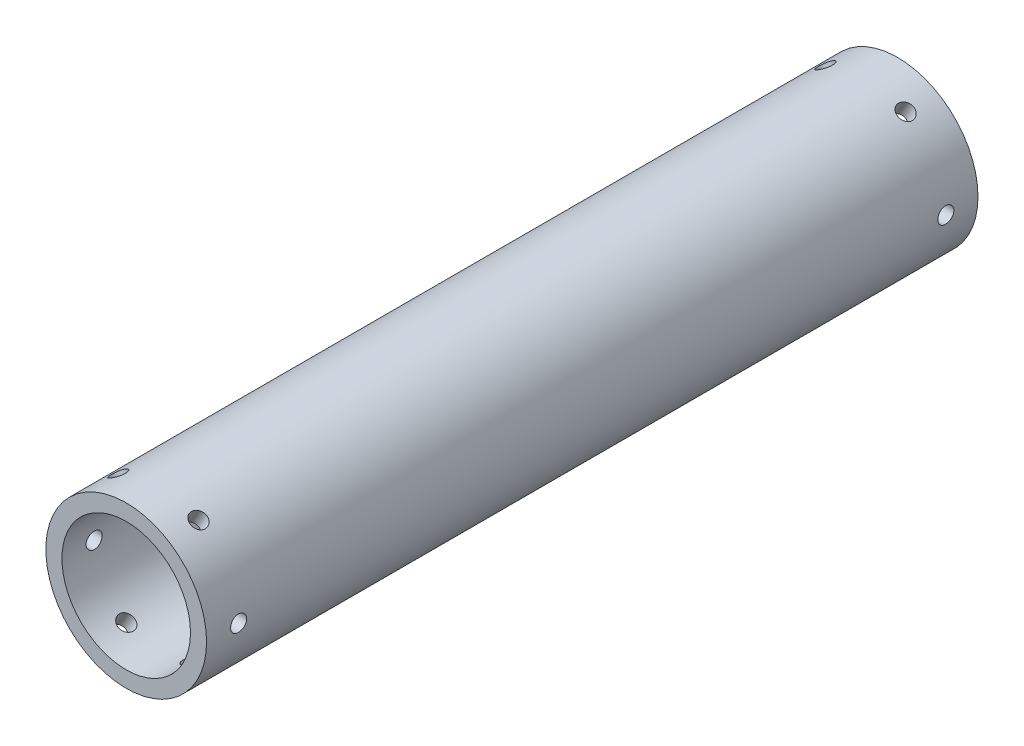
from build123d import *

# Parameters (mm, degrees)
SKETCH2_R         = 31.75
SKETCH2_R_2       = 25.4
BASE_DEPTH        = 304.8
BOLTHOLES_REACH   = 314.959
SKETCH3_R         = 3.175
CIRPATTERN1_COUNT = 6


with BuildPart() as part:
    # Sketch2 → base (new body)
    with BuildSketch(Plane(origin=(0, 0, 0), x_dir=(0, 1, 0), z_dir=(0, 0, 1))):
        Circle(SKETCH2_R)
        Circle(SKETCH2_R_2, mode=Mode.SUBTRACT)
    extrude(amount=BASE_DEPTH)

    # Sketch3 → boltholes (cut, up to next)
    with BuildSketch(Plane.ZY.offset(31.75), mode=Mode.PRIVATE) as boltholes_sk1:
        with Locations((12.7, 0)):
            Circle(SKETCH3_R)
    boltholes_tool1 = extrude(boltholes_sk1.sketch, amount=-BOLTHOLES_REACH, mode=Mode.PRIVATE) & part.part
    # Sketch3 → boltholes (cut, up to next)
    with BuildSketch(Plane.ZY.offset(31.75), mode=Mode.PRIVATE) as boltholes_sk2:
        with Locations((292.1, 0)):
            Circle(SKETCH3_R)
    boltholes_tool2 = extrude(boltholes_sk2.sketch, amount=-BOLTHOLES_REACH, mode=Mode.PRIVATE) & part.part
    boltholes_1 = boltholes_tool1.solids().sort_by_distance((-31.75, 0, 12.7))[0]
    add(boltholes_1, mode=Mode.SUBTRACT)
    boltholes_2 = boltholes_tool2.solids().sort_by_distance((-31.75, 0, 292.1))[0]
    add(boltholes_2, mode=Mode.SUBTRACT)
    boltholes = boltholes_1 + boltholes_2  # boltholes as one shape, for the pattern or mirror that repeats it

    # CirPattern1: boltholes ×6 about axis
    cirpattern1_axis = Axis((0, 0, 304.8), (0, 0, -1))
    for i in range(1, CIRPATTERN1_COUNT):
        add(boltholes.rotate(cirpattern1_axis, i * 360 / CIRPATTERN1_COUNT), mode=Mode.SUBTRACT)


solid = part.part
